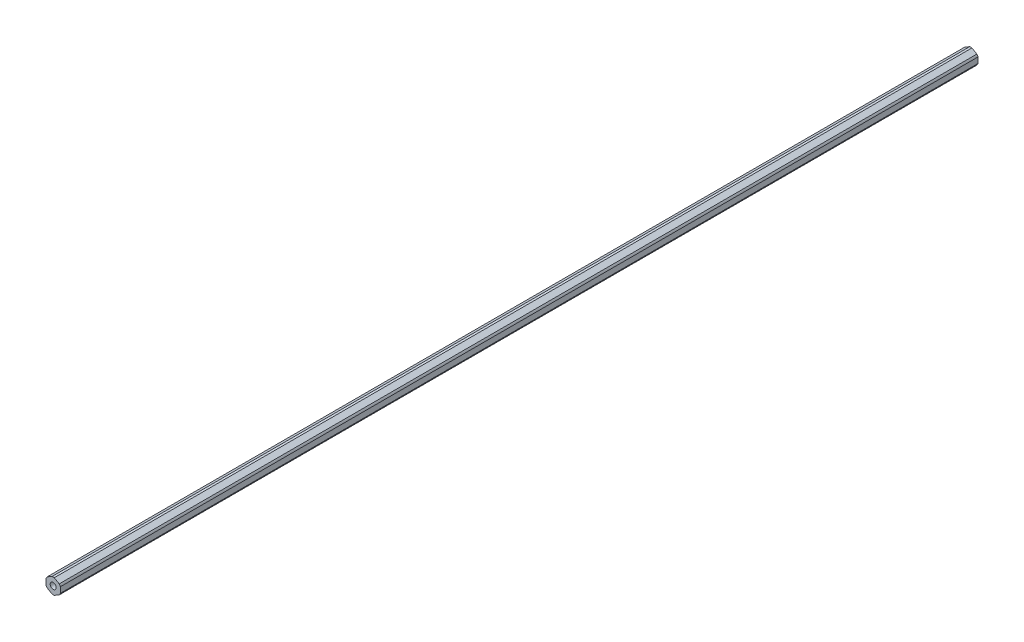
from build123d import *

# Parameters (mm, degrees)
SKETCH2_R                            = 2.0193
BOSS_EXTRUDE1_DEPTH                  = 304.8
F_10_32_TAPPED_HOLE2_D               = 4.0386
F_10_32_TAPPED_HOLE2_DEPTH           = 12.02944
F_10_32_TAPPED_HOLE2_TIP             = 1.213317848
F_10_32_TAPPED_HOLE2_ON_FACE_2_D     = 4.0386
F_10_32_TAPPED_HOLE2_ON_FACE_2_DEPTH = 12.02944
F_10_32_TAPPED_HOLE2_ON_FACE_2_TIP   = 1.213317848


with BuildPart() as part:
    # Sketch2 → Boss-Extrude1 (new, symmetric)
    with BuildSketch(Plane.XY):
        with BuildLine():
            ThreePointArc((0.741687758, 5.071047688), (0, 5.125000037), (-0.741687758, 5.071047688))
            Line((-0.741687758, 5.071047688), (-4.020812242, 3.177844283))
            ThreePointArc((-4.020812242, 3.177844283), (-4.438380226, 2.562500019), (-4.7625, 1.893203404))
            Line((-4.7625, 1.893203404), (-4.7625, -1.893203404))
            ThreePointArc((-4.7625, -1.893203404), (-4.438380226, -2.562500019), (-4.020812242, -3.177844283))
            Line((-4.020812242, -3.177844283), (-0.741687758, -5.071047688))
            ThreePointArc((-0.741687758, -5.071047688), (0, -5.125000037), (0.741687758, -5.071047688))
            Line((0.741687758, -5.071047688), (4.020812242, -3.177844283))
            ThreePointArc((4.020812242, -3.177844283), (4.438380226, -2.562500019), (4.7625, -1.893203404))
            Line((4.7625, -1.893203404), (4.7625, 1.893203404))
            ThreePointArc((4.7625, 1.893203404), (4.438380226, 2.562500019), (4.020812242, 3.177844283))
            Line((4.020812242, 3.177844283), (0.741687758, 5.071047688))
        make_face()
        Circle(SKETCH2_R, mode=Mode.SUBTRACT)
    extrude(amount=BOSS_EXTRUDE1_DEPTH, both=True)

    # #10-32 Tapped Hole2
    with Locations(Plane(origin=(0, 0, -304.8), x_dir=(-1, 0, 0), z_dir=(0, 0, -1))):
        with Locations((0, 0)):
            Hole(F_10_32_TAPPED_HOLE2_D / 2, depth=F_10_32_TAPPED_HOLE2_DEPTH)
            with Locations((0, 0, -(F_10_32_TAPPED_HOLE2_DEPTH + F_10_32_TAPPED_HOLE2_TIP / 2))):  # 118° drill point
                Cone(0, F_10_32_TAPPED_HOLE2_D / 2, F_10_32_TAPPED_HOLE2_TIP, mode=Mode.SUBTRACT)

    # #10-32 Tapped Hole2 on face 2
    with Locations(Plane(origin=(0, 0, 304.8), x_dir=(-1, 0, 0), z_dir=(0, 0, -1))):
        with Locations((0, 0)):
            Hole(F_10_32_TAPPED_HOLE2_ON_FACE_2_D / 2, depth=F_10_32_TAPPED_HOLE2_ON_FACE_2_DEPTH)
            with Locations((0, 0, -(F_10_32_TAPPED_HOLE2_ON_FACE_2_DEPTH + F_10_32_TAPPED_HOLE2_ON_FACE_2_TIP / 2))):  # 118° drill point
                Cone(0, F_10_32_TAPPED_HOLE2_ON_FACE_2_D / 2, F_10_32_TAPPED_HOLE2_ON_FACE_2_TIP, mode=Mode.SUBTRACT)


solid = part.part
